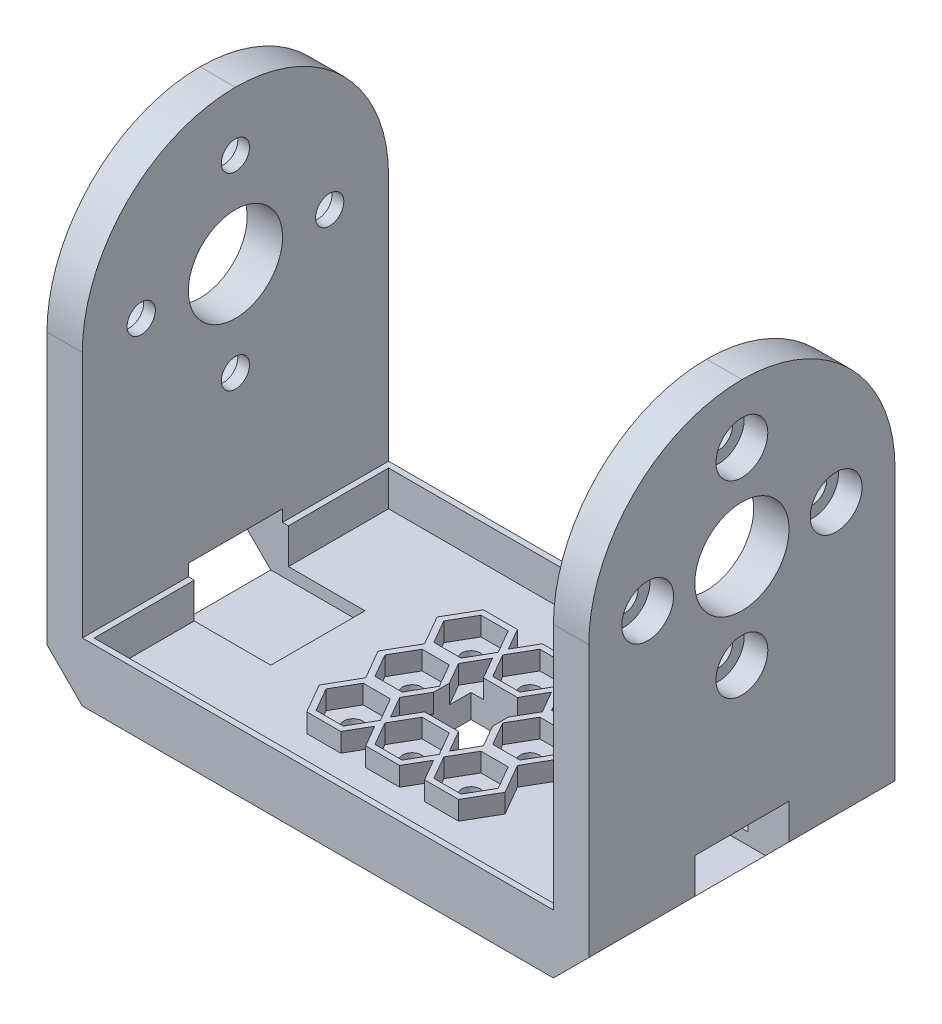
from build123d import *

# Parameters (mm, degrees)
SKETCH_1_W                   = 46
SKETCH_1_H                   = 26
EXTRUDE_1_DEPTH              = 5
SKETCH_2_W                   = 3
SKETCH_2_H                   = 26
EXTRUDE_2_DEPTH              = 34
FILLET_1_R                   = 13
CUT_EXTRUDE_1_REACH          = 63.693
SKETCH_3_R                   = 4
HOLE_WIZARD_M2_1_D           = 2.4
HOLE_WIZARD_M2_1_CBORE_D     = 4.4
HOLE_WIZARD_M2_1_CBORE_DEPTH = 2
SKETCH_6_W                   = 39
SKETCH_6_H                   = 25
CUT_EXTRUDE_3_DEPTH          = 3
CHAMFER_1_SIZE               = 3
EXTRUDE_3_DEPTH              = 1.6
SKETCH_9_W                   = 8
SKETCH_9_H                   = 5
CUT_EXTRUDE_4_DEPTH          = 10
SKETCH_10_W                  = 5
SKETCH_10_H                  = 5
CUT_EXTRUDE_5_DEPTH          = 10
M2X0_4_1_D                   = 1.6


with BuildPart() as part:
    # 草图1 → 凸台-拉伸1 (new body)
    with BuildSketch(Plane(origin=(0, 0, 0), x_dir=(1, 0, 0), z_dir=(0, 1, 0))):
        Rectangle(SKETCH_1_W, SKETCH_1_H)
    extrude(amount=EXTRUDE_1_DEPTH)

    # 草图2 → 凸台-拉伸2 (add)
    with BuildSketch(Plane(origin=(0, 5, 0), x_dir=(1, 0, 0), z_dir=(0, 1, 0))):
        with Locations((-21.5, 0)):
            Rectangle(SKETCH_2_W, SKETCH_2_H)
        with Locations((21.5, 0)):
            Rectangle(SKETCH_2_W, SKETCH_2_H)
    extrude(amount=EXTRUDE_2_DEPTH)

    # 圆角1
    fillet_1_edges = [part.edges().sort_by_distance(p)[0] for p in [
        (21.5, 39, -13),
        (-21.5, 39, -13),
        (21.5, 39, 13),
        (-21.5, 39, 13),
    ]]
    fillet(fillet_1_edges, radius=FILLET_1_R - 0.0001)  # a hair under: the kernel refuses the full size

    # 草图3 → 切除-拉伸1 (cut, up to next)
    with BuildSketch(Plane.ZY.offset(23), mode=Mode.PRIVATE) as cut_extrude_1_sk1:
        with Locations((0, 26)):
            Circle(SKETCH_3_R)
    cut_extrude_1_tool1 = extrude(cut_extrude_1_sk1.sketch, amount=-CUT_EXTRUDE_1_REACH, mode=Mode.PRIVATE) & part.part
    cut_extrude_1 = cut_extrude_1_tool1.solids().sort_by_distance((-23, 26, 0))[0]
    add(cut_extrude_1, mode=Mode.SUBTRACT)

    # M2 凹头盖螺钉的柱形沉头孔1 (through all)
    with Locations(Plane(origin=(-23, 26, -8), x_dir=(0, 0, -1), z_dir=(-1, 0, 0))):
        with Locations((0, 0), (-8, -8), (-16, 0), (-8, 8)):
            hole_wizard_m2_1 = CounterBoreHole(HOLE_WIZARD_M2_1_D / 2, HOLE_WIZARD_M2_1_CBORE_D / 2, HOLE_WIZARD_M2_1_CBORE_DEPTH)

    # 镜向1: 切除-拉伸1, M2 凹头盖螺钉的柱形沉头孔1 across plane
    add(cut_extrude_1.mirror(Plane(origin=(0, 0, 0), x_dir=(0, 0, 1), z_dir=(1, 0, 0))), mode=Mode.SUBTRACT)
    add(hole_wizard_m2_1.mirror(Plane(origin=(0, 0, 0), x_dir=(0, 0, 1), z_dir=(1, 0, 0))), mode=Mode.SUBTRACT)

    # 草图6 → 切除-拉伸3 (cut)
    with BuildSketch(Plane(origin=(0, 5, 0), x_dir=(1, 0, 0), z_dir=(0, 1, 0))):
        Rectangle(SKETCH_6_W, SKETCH_6_H)
    extrude(amount=-CUT_EXTRUDE_3_DEPTH, mode=Mode.SUBTRACT)

    # 倒角1
    chamfer_1_edges = [part.edges().sort_by_distance(p)[0] for p in [
        (-23, 0, 0),
        (23, 0, 0),
    ]]
    chamfer(chamfer_1_edges, length=CHAMFER_1_SIZE)

    # 草图7 → 凸台-拉伸3 (add)
    # profile 1 of 3: a face of its own
    with BuildSketch(Plane(origin=(0, 2, 0), x_dir=(1, 0, 0), z_dir=(0, 1, 0))):
        Polygon((7.886751346, 5), (6.443375673, 7.5), (3.556624327, 7.5), (2.5, 5.669872981), (1.443375673, 7.5), (-1.443375673, 7.5), (-2.5, 5.669872981), (-3.556624327, 7.5), (-6.443375673, 7.5), (-7.886751346, 5), (-6.443375673, 2.5), (-3.556624327, 2.5), (-2.5, 4.330127019), (-1.443375673, 2.5), (1.443375673, 2.5), (2.5, 4.330127019), (3.556624327, 2.5), (6.443375673, 2.5), align=None)
        Polygon((-3.845299462, 3), (-2.690598923, 5), (-3.845299462, 7), (-6.154700538, 7), (-7.309401077, 5), (-6.154700538, 3), align=None, mode=Mode.SUBTRACT)
        Polygon((-2.309401077, 5), (-1.154700538, 3), (1.154700538, 3), (2.309401077, 5), (1.154700538, 7), (-1.154700538, 7), align=None, mode=Mode.SUBTRACT)
        Polygon((2.690598923, 5), (3.845299462, 3), (6.154700538, 3), (7.309401077, 5), (6.154700538, 7), (3.845299462, 7), align=None, mode=Mode.SUBTRACT)
    # profile 2 of 3: a face of its own
    with BuildSketch(Plane(origin=(0, 2, 0), x_dir=(1, 0, 0), z_dir=(0, 1, 0))):
        Polygon((3.556624327, 2.5), (2.5, 0.669872981), (1.443375673, 2.5), (-1.443375673, 2.5), (-2.5, 0.669872981), (-3.556624327, 2.5), (-6.443375673, 2.5), (-7.886751346, 0), (-6.443375673, -2.5), (-3.556624327, -2.5), (-2.5, -0.669872981), (-1.443375673, -2.5), (1.443375673, -2.5), (2.5, -0.669872981), (3.556624327, -2.5), (6.443375673, -2.5), (7.886751346, 0), (6.443375673, 2.5), align=None)
        Polygon((-2.309401077, 0), (-1.154700538, -2), (1.154700538, -2), (2.309401077, 0), (1.154700538, 2), (-1.154700538, 2), align=None, mode=Mode.SUBTRACT)
        Polygon((2.690598923, 0), (3.845299462, -2), (6.154700538, -2), (7.309401077, 0), (6.154700538, 2), (3.845299462, 2), align=None, mode=Mode.SUBTRACT)
        Polygon((-7.309401077, 0), (-6.154700538, -2), (-3.845299462, -2), (-2.690598923, 0), (-3.845299462, 2), (-6.154700538, 2), align=None, mode=Mode.SUBTRACT)
    # profile 3 of 3: a face of its own
    with BuildSketch(Plane(origin=(0, 2, 0), x_dir=(1, 0, 0), z_dir=(0, 1, 0))):
        Polygon((3.556624327, -2.5), (2.5, -4.330127019), (1.443375673, -2.5), (-1.443375673, -2.5), (-2.5, -4.330127019), (-3.556624327, -2.5), (-6.443375673, -2.5), (-7.886751346, -5), (-6.443375673, -7.5), (-3.556624327, -7.5), (-2.5, -5.669872981), (-1.443375673, -7.5), (1.443375673, -7.5), (2.5, -5.669872981), (3.556624327, -7.5), (6.443375673, -7.5), (7.886751346, -5), (6.443375673, -2.5), align=None)
        Polygon((-2.309401077, -5), (-1.154700538, -7), (1.154700538, -7), (2.309401077, -5), (1.154700538, -3), (-1.154700538, -3), align=None, mode=Mode.SUBTRACT)
        Polygon((2.690598923, -5), (3.845299462, -7), (6.154700538, -7), (7.309401077, -5), (6.154700538, -3), (3.845299462, -3), align=None, mode=Mode.SUBTRACT)
        Polygon((-7.309401077, -5), (-6.154700538, -7), (-3.845299462, -7), (-2.690598923, -5), (-3.845299462, -3), (-6.154700538, -3), align=None, mode=Mode.SUBTRACT)
    extrude(amount=EXTRUDE_3_DEPTH)

    # 草图9 → 切除-拉伸4 (cut)
    with BuildSketch(Plane.ZY.offset(23)):
        with Locations((0, 3.5)):
            Rectangle(SKETCH_9_W, SKETCH_9_H)
    cut_extrude_4 = extrude(amount=-CUT_EXTRUDE_4_DEPTH, mode=Mode.SUBTRACT)

    # 镜向2: 切除-拉伸4 across plane
    add(cut_extrude_4.mirror(Plane(origin=(0, 0, 0), x_dir=(0, 0, 1), z_dir=(1, 0, 0))), mode=Mode.SUBTRACT)

    # 草图10 → 切除-拉伸5 (cut)
    with BuildSketch(Plane(origin=(0, 3.6, 0), x_dir=(1, 0, 0), z_dir=(0, 1, 0))):
        Rectangle(SKETCH_10_W, SKETCH_10_H)
    extrude(amount=-CUT_EXTRUDE_5_DEPTH, mode=Mode.SUBTRACT)

    # M2x0.4 螺纹孔1 (through all)
    with Locations(Plane(origin=(-5, 2, -5), x_dir=(0, 0, 1), z_dir=(0, 1, 0))):
        with Locations((0, 0), (0, 5), (0, 10), (5, 10), (5, 0), (10, 0), (10, 5), (10, 10)):
            Hole(M2X0_4_1_D / 2)


solid = part.part
